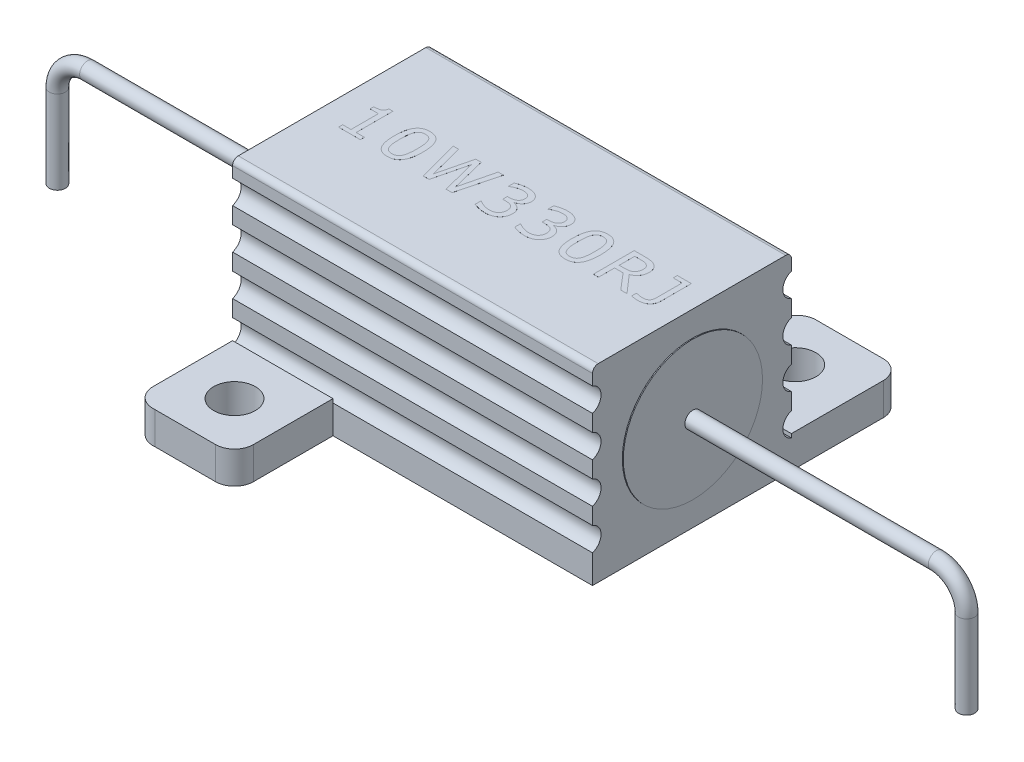
from build123d import *

# Parameters (mm, degrees)
BOSS_EXTRUDE1_DEPTH = 9.5
SKETCH2_R           = 1.1
BOSS_EXTRUDE2_DEPTH = 1.7
SKETCH3_R           = 3.675
BOSS_EXTRUDE3_DEPTH = 9.55
BOSS_EXTRUDE6_DEPTH = 0.001
SWEEP1_PROFILE_R    = 0.425


with BuildPart() as part:
    # Sketch1 → Boss-Extrude1 (new, symmetric)
    with BuildSketch(Plane(origin=(0, 0, 0), x_dir=(0, 0, -1), z_dir=(1, 0, 0))):
        with BuildLine():
            Line((-4.95, 5), (4.95, 5))
            ThreePointArc((4.95, 5), (5.162132034, 4.912132034), (5.25, 4.7))
            Line((5.25, 4.7), (5.25, 4.125))
            ThreePointArc((5.25, 4.125), (4.8, 3.5), (5.25, 2.875))
            Line((5.25, 2.875), (5.25, 2))
            ThreePointArc((5.25, 2), (4.8, 1.375), (5.25, 0.75))
            Line((5.25, 0.75), (5.25, -0.125))
            ThreePointArc((5.25, -0.125), (4.8, -0.75), (5.25, -1.375))
            Line((5.25, -1.375), (5.25, -2.25))
            ThreePointArc((5.25, -2.25), (4.8, -2.875), (5.25, -3.5))
            Line((5.25, -3.5), (5.25, -5))
            Line((5.25, -5), (-5.25, -5))
            Line((-5.25, -5), (-5.25, -3.5))
            ThreePointArc((-5.25, -3.5), (-4.8, -2.875), (-5.25, -2.25))
            Line((-5.25, -2.25), (-5.25, -1.375))
            ThreePointArc((-5.25, -1.375), (-4.8, -0.75), (-5.25, -0.125))
            Line((-5.25, -0.125), (-5.25, 0.75))
            ThreePointArc((-5.25, 0.75), (-4.8, 1.375), (-5.25, 2))
            Line((-5.25, 2), (-5.25, 2.875))
            ThreePointArc((-5.25, 2.875), (-4.8, 3.5), (-5.25, 4.125))
            Line((-5.25, 4.125), (-5.25, 4.7))
            ThreePointArc((-5.25, 4.7), (-5.162132034, 4.912132034), (-4.95, 5))
        make_face()
    extrude(amount=BOSS_EXTRUDE1_DEPTH, both=True)

    # Sketch2 → Boss-Extrude2 (add)
    # profile 1 of 2: a face of its own
    with BuildSketch(Plane.XZ.offset(5)):
        with BuildLine():
            Line((-4.2, 9.45), (-4.2, 5.25))
            Line((-4.2, 5.25), (-9.5, 5.25))
            Line((-9.5, 5.25), (-9.5, 9.455012563))
            ThreePointArc((-9.5, 9.455012563), (-9.170820393, 10.196632412), (-8.4, 10.45))
            Line((-8.4, 10.45), (-5.2, 10.45))
            ThreePointArc((-5.2, 10.45), (-4.492893219, 10.157106781), (-4.2, 9.45))
        make_face()
        with Locations((-6.8, 7.85)):
            Circle(SKETCH2_R, mode=Mode.SUBTRACT)
    # profile 2 of 2: a face of its own
    with BuildSketch(Plane.XZ.offset(5)):
        with BuildLine():
            Line((4, -9.8), (4, -5.25))
            Line((4, -5.25), (9.5, -5.25))
            Line((9.5, -5.25), (9.5, -10.1))
            ThreePointArc((9.5, -10.1), (9.207106781, -10.807106781), (8.5, -11.1))
            Line((8.5, -11.1), (5, -11.1))
            ThreePointArc((5, -11.1), (4.160975821, -10.71078783), (4, -9.8))
        make_face()
        with Locations((6.45, -8.5)):
            Circle(SKETCH2_R, mode=Mode.SUBTRACT)
    extrude(amount=-BOSS_EXTRUDE2_DEPTH)

    # Sketch3 → Boss-Extrude3 (add, symmetric)
    with BuildSketch(Plane(origin=(0, 0, 0), x_dir=(0, 0, -1), z_dir=(1, 0, 0))):
        Circle(SKETCH3_R)
    extrude(amount=BOSS_EXTRUDE3_DEPTH, both=True)

    # Sketch7 → Boss-Extrude6 (add)
    # profile 1 of 8: a face of its own
    with BuildSketch(Plane(origin=(0, 5, 0), x_dir=(1, 0, 0), z_dir=(0, 1, 0))):
        with BuildLine():
            add(Edge.make_bspline(
                [(8.301500939, -0.428209134), (8.301062759, -0.451139319), (8.300207962, -0.495871214), (8.29201733, -0.560917209), (8.278328298, -0.621921589), (8.259611151, -0.678890096), (8.235685509, -0.732088674), (8.205617016, -0.780816478), (8.170282201, -0.825541687), (8.130173555, -0.866207529), (8.085145884, -0.902021533), (8.036294909, -0.933177949), (7.983967978, -0.959998554), (7.927662195, -0.980985193), (7.868126832, -0.99839108), (7.804646886, -1.010168803), (7.737531753, -1.016882767), (7.691588805, -1.01795472), (7.66809833, -1.018502806)],
                knots=[0, 0, 0, 0, 1.120755748, 2.186355242, 3.198933757, 4.173448826, 5.113591064, 6.0441882, 6.96548279, 7.895169476, 8.830564272, 9.772249413, 10.724232925, 11.699641407, 12.705819706, 13.753628003, 14.85143754, 16, 16, 16, 16], degree=3))
            add(Edge.make_bspline(
                [(7.66809833, -1.018502806), (7.655576493, -1.018281429), (7.628669118, -1.017805726), (7.585391188, -1.015631182), (7.536466535, -1.011576798), (7.483500798, -1.006784825), (7.430017002, -1.000454105), (7.379492216, -0.993714401), (7.333455228, -0.98665922), (7.304569248, -0.980766212), (7.29078842, -0.977954795)],
                knots=[0, 0, 0, 0, 0.791051374, 1.699839779, 2.736493337, 3.89186054, 5.058981669, 6.138045988, 7.111705107, 8, 8, 8, 8], degree=3))
            Line((7.29078842, -0.977954795), (7.29078842, -0.718020706))
            Line((7.29078842, -0.718020706), (7.307007624, -0.718020706))
            add(Edge.make_bspline(
                [(7.307007624, -0.718020706), (7.317518242, -0.721073113), (7.339727339, -0.727522896), (7.374934936, -0.736281462), (7.413680531, -0.745198697), (7.469865845, -0.758120324), (7.544005961, -0.769903904), (7.604451824, -0.771734522), (7.634806279, -0.772653815)],
                knots=[0, 0, 0, 0, 0.590882725, 1.248544343, 1.958456919, 2.737484183, 4.36164324, 6, 6, 6, 6], degree=3))
            add(Edge.make_bspline(
                [(7.634806279, -0.772653815), (7.656166994, -0.772461792), (7.696565415, -0.77209863), (7.753750946, -0.765824302), (7.804166318, -0.756974089), (7.848135312, -0.743827985), (7.885713307, -0.726302863), (7.918530574, -0.706683731), (7.945823511, -0.682713598), (7.959908837, -0.664069505), (7.966873146, -0.654851173)],
                knots=[0, 0, 0, 0, 1.398250317, 2.64443893, 3.76295224, 4.747439987, 5.639718209, 6.472395588, 7.244695641, 8, 8, 8, 8], degree=3))
            add(Edge.make_bspline(
                [(7.966873146, -0.654851173), (7.973123074, -0.644754521), (7.985890653, -0.624128716), (8.00018326, -0.589718454), (8.010856248, -0.552166937), (8.01792722, -0.511357587), (8.022046048, -0.467230454), (8.026382554, -0.420034325), (8.027586578, -0.36945425), (8.028080428, -0.334734153), (8.028335394, -0.31680881)],
                knots=[0, 0, 0, 0, 0.816858895, 1.668708864, 2.555793622, 3.501563013, 4.516682111, 5.608029468, 6.765069871, 8, 8, 8, 8], degree=3))
            Line((8.028335394, -0.31680881), (8.028335394, 0.948289124))
            Line((8.028335394, 0.948289124), (7.563953966, 0.948289124))
            Line((7.563953966, 0.948289124), (7.563953966, 1.166821561))
            Line((7.563953966, 1.166821561), (8.301500939, 1.166821561))
            Line((8.301500939, 1.166821561), (8.301500939, -0.428209134))
        make_face()
    # profile 2 of 8: a face of its own
    with BuildSketch(Plane(origin=(0, 5, 0), x_dir=(1, 0, 0), z_dir=(0, 1, 0))):
        with BuildLine():
            Line((7.061329361, -0.991186252), (6.732677064, -0.991186252))
            Line((6.732677064, -0.991186252), (6.009642009, -0.144373059))
            Line((6.009642009, -0.144373059), (5.558918859, -0.144373059))
            Line((5.558918859, -0.144373059), (5.558918859, -0.991186252))
            Line((5.558918859, -0.991186252), (5.285753313, -0.991186252))
            Line((5.285753313, -0.991186252), (5.285753313, 1.166821561))
            Line((5.285753313, 1.166821561), (5.881168839, 1.166821561))
            add(Edge.make_bspline(
                [(5.881168839, 1.166821561), (5.911904641, 1.166472923), (5.970853538, 1.165804262), (6.055196595, 1.161362849), (6.131528924, 1.153188929), (6.200821451, 1.142460798), (6.264493868, 1.126868517), (6.324352246, 1.106865387), (6.38084595, 1.081349474), (6.416018135, 1.06031351), (6.433475427, 1.049872562)],
                knots=[0, 0, 0, 0, 1.288415781, 2.47108201, 3.538680541, 4.505415573, 5.408010686, 6.28309489, 7.147834801, 8, 8, 8, 8], degree=3))
            add(Edge.make_bspline(
                [(6.433475427, 1.049872562), (6.452026827, 1.037078239), (6.488585095, 1.011865139), (6.537119705, 0.96673622), (6.579672909, 0.917229328), (6.615529177, 0.862228728), (6.645093896, 0.801194489), (6.664320145, 0.732114873), (6.677231551, 0.655974161), (6.678326802, 0.602624186), (6.678897597, 0.574820604)],
                knots=[0, 0, 0, 0, 0.963681284, 1.899076006, 2.827943621, 3.752026167, 4.702860247, 5.71857009, 6.811022445, 8, 8, 8, 8], degree=3))
            add(Edge.make_bspline(
                [(6.678897597, 0.574820604), (6.678625354, 0.555598427), (6.678091765, 0.517923456), (6.672258237, 0.462607834), (6.663428322, 0.409685206), (6.651117052, 0.358950296), (6.6348117, 0.310761633), (6.615286137, 0.264774292), (6.591531855, 0.221526872), (6.564676259, 0.18058669), (6.534747071, 0.141998395), (6.501618388, 0.106199002), (6.466249688, 0.072220036), (6.427699426, 0.041172177), (6.386656883, 0.012446678), (6.342851411, -0.013476084), (6.29674251, -0.037756999), (6.264283621, -0.051287438), (6.24780822, -0.058155184)],
                knots=[0, 0, 0, 0, 1.126128489, 2.207182719, 3.255820935, 4.268986334, 5.263032379, 6.234153775, 7.193063852, 8.150486488, 9.10116855, 10.051301984, 11.006725633, 11.972966631, 12.949086479, 13.94005042, 14.954415947, 16, 16, 16, 16], degree=3))
            Line((6.24780822, -0.058155184), (7.061329361, -0.991186252))
        make_face()
        with BuildLine():
            add(Edge.make_bspline(
                [(6.378415496, 0.557747758), (6.377971198, 0.572844297), (6.377099984, 0.602446679), (6.371324006, 0.645451141), (6.360741748, 0.685692535), (6.3469982, 0.723523011), (6.327871321, 0.758604596), (6.303778717, 0.790961831), (6.274058419, 0.820260432), (6.251042386, 0.836627929), (6.239271797, 0.844998402)],
                knots=[0, 0, 0, 0, 1.085368415, 2.128268547, 3.1106313, 4.071895604, 5.014699805, 5.972038339, 6.962883605, 8, 8, 8, 8], degree=3))
            add(Edge.make_bspline(
                [(6.239271797, 0.844998402), (6.228604901, 0.85180502), (6.207086192, 0.865536253), (6.17141029, 0.881662578), (6.133145922, 0.894956933), (6.091691298, 0.904385193), (6.047293245, 0.912407267), (5.999182294, 0.916968655), (5.947387007, 0.920798106), (5.911624057, 0.92091308), (5.893119831, 0.92097257)],
                knots=[0, 0, 0, 0, 0.843459406, 1.701540853, 2.6053125, 3.542575708, 4.535326681, 5.614234208, 6.765573065, 8, 8, 8, 8], degree=3))
            Line((5.893119831, 0.92097257), (5.558918859, 0.92097257))
            Line((5.558918859, 0.92097257), (5.558918859, 0.101475932))
            Line((5.558918859, 0.101475932), (5.846169503, 0.101475932))
            add(Edge.make_bspline(
                [(5.846169503, 0.101475932), (5.867940616, 0.101875983), (5.910102619, 0.102650723), (5.971162163, 0.106530503), (6.027777382, 0.114646486), (6.080634985, 0.124057898), (6.129372962, 0.139365906), (6.174597803, 0.158655492), (6.215627535, 0.184205627), (6.239932801, 0.204747189), (6.252076431, 0.215010362)],
                knots=[0, 0, 0, 0, 1.210655428, 2.344558938, 3.398352313, 4.389640028, 5.325372474, 6.232137918, 7.116723723, 8, 8, 8, 8], degree=3))
            add(Edge.make_bspline(
                [(6.252076431, 0.215010362), (6.262457948, 0.225435283), (6.282891639, 0.245954405), (6.308447076, 0.280726063), (6.330481884, 0.317018657), (6.348305899, 0.35624545), (6.362124373, 0.399316777), (6.371832469, 0.447392266), (6.377073819, 0.500864381), (6.377955501, 0.538245239), (6.378415496, 0.557747758)],
                knots=[0, 0, 0, 0, 0.936271895, 1.842841591, 2.741489519, 3.638077323, 4.58130199, 5.617848582, 6.75717263, 8, 8, 8, 8], degree=3))
        make_face(mode=Mode.SUBTRACT)
    # profile 3 of 8: a face of its own
    with BuildSketch(Plane(origin=(0, 5, 0), x_dir=(1, 0, 0), z_dir=(0, 1, 0))):
        with BuildLine():
            add(Edge.make_bspline(
                [(4.591912826, 0.089098118), (4.591353613, 0.041848931), (4.590272953, -0.049458383), (4.581610809, -0.181638091), (4.567992152, -0.304102208), (4.548113125, -0.416947039), (4.522086392, -0.519875811), (4.491359082, -0.613537941), (4.454273883, -0.697330653), (4.411111584, -0.771557169), (4.361383045, -0.836281508), (4.306227081, -0.89291909), (4.243999476, -0.940318371), (4.175378527, -0.978887087), (4.100625831, -1.009523582), (4.01934013, -1.030460626), (3.932048472, -1.043592204), (3.871772552, -1.045061906), (3.840707575, -1.045819361)],
                knots=[0, 0, 0, 0, 1.462515791, 2.826257887, 4.098588437, 5.27524076, 6.370122553, 7.382635979, 8.323051561, 9.201518962, 10.033957328, 10.843681618, 11.641751814, 12.446417794, 13.274089048, 14.135116487, 15.038877147, 16, 16, 16, 16], degree=3))
            add(Edge.make_bspline(
                [(3.840707575, -1.045819361), (3.809212218, -1.045098232), (3.74805899, -1.043698047), (3.659634021, -1.030066088), (3.5776768, -1.008737016), (3.502453028, -0.977966512), (3.433460505, -0.939199462), (3.371546893, -0.890664903), (3.315852417, -0.833906211), (3.267463826, -0.767632726), (3.225245962, -0.692694118), (3.188330153, -0.608837037), (3.158064046, -0.515475498), (3.133099403, -0.412986518), (3.113023383, -0.301410168), (3.099241818, -0.18037659), (3.091304605, -0.050010601), (3.090116532, 0.040002392), (3.089502324, 0.086537191)],
                knots=[0, 0, 0, 0, 0.975561823, 1.894207913, 2.765987644, 3.594712337, 4.406414096, 5.210884434, 6.024787292, 6.863552976, 7.746360406, 8.68618482, 9.698595331, 10.784175386, 11.95364431, 13.210072149, 14.557666754, 16, 16, 16, 16], degree=3))
            add(Edge.make_bspline(
                [(3.089502324, 0.086537191), (3.090065458, 0.133359552), (3.091155063, 0.223956004), (3.099777381, 0.355000449), (3.113451301, 0.476611919), (3.133437337, 0.588673687), (3.158839964, 0.691437414), (3.189724778, 0.785011098), (3.226741865, 0.86901978), (3.26958212, 0.943767297), (3.318583977, 1.009428031), (3.37406986, 1.066527212), (3.436481632, 1.114483883), (3.504939473, 1.154241965), (3.57996298, 1.184704721), (3.661388042, 1.205601292), (3.748902543, 1.219364942), (3.809494326, 1.220744173), (3.840707575, 1.22145467)],
                knots=[0, 0, 0, 0, 1.450126419, 2.805845482, 4.065763501, 5.238744047, 6.328896909, 7.341983365, 8.2869572, 9.167511018, 10.004780552, 10.818108853, 11.62549425, 12.434993413, 13.263133086, 14.124647823, 15.033931127, 16, 16, 16, 16], degree=3))
            add(Edge.make_bspline(
                [(3.840707575, 1.22145467), (3.872198672, 1.220719142), (3.933343628, 1.219290997), (4.021863604, 1.205850454), (4.103830389, 1.183766123), (4.179386413, 1.15307733), (4.247893205, 1.112871696), (4.310048073, 1.06419704), (4.36557078, 1.006491624), (4.413826829, 0.939473181), (4.456306068, 0.863970861), (4.492829151, 0.779667173), (4.523323976, 0.686246914), (4.548896734, 0.584304748), (4.568214851, 0.473149532), (4.582207954, 0.353177198), (4.590091653, 0.224079336), (4.591292665, 0.135063048), (4.591912826, 0.089098118)],
                knots=[0, 0, 0, 0, 0.976576377, 1.896177831, 2.770013405, 3.605358433, 4.418491692, 5.226516336, 6.047603033, 6.894359061, 7.781924088, 8.73081062, 9.740083278, 10.827858728, 11.989075843, 13.238041405, 14.5738202, 16, 16, 16, 16], degree=3))
        make_face()
        with BuildLine():
            add(Edge.make_bspline(
                [(4.204786029, -0.571621046), (4.212790423, -0.551103816), (4.229194022, -0.509057354), (4.24826829, -0.441937656), (4.262958171, -0.369841197), (4.27394369, -0.292130347), (4.281927947, -0.207948723), (4.287228022, -0.116116364), (4.290682758, -0.016210645), (4.291175043, 0.053099756), (4.291430726, 0.089098118)],
                knots=[0, 0, 0, 0, 0.787920239, 1.614704221, 2.493559176, 3.419679904, 4.422442709, 5.519279532, 6.711566037, 8, 8, 8, 8], degree=3))
            add(Edge.make_bspline(
                [(4.291430726, 0.089098118), (4.291172523, 0.124811988), (4.290673481, 0.193837932), (4.287219407, 0.293599845), (4.281890217, 0.386144012), (4.273857773, 0.471584061), (4.263298559, 0.550551176), (4.247721713, 0.622773387), (4.229217685, 0.689254479), (4.211897155, 0.730051576), (4.203505566, 0.749817282)],
                knots=[0, 0, 0, 0, 1.277209098, 2.468524563, 3.569546968, 4.59175249, 5.537266852, 6.41645201, 7.232789931, 8, 8, 8, 8], degree=3))
            add(Edge.make_bspline(
                [(4.203505566, 0.749817282), (4.194664368, 0.767537488), (4.177466934, 0.8020059), (4.145564361, 0.848757326), (4.107644428, 0.887422179), (4.06599911, 0.920240868), (4.018280356, 0.945380836), (3.964698204, 0.963246088), (3.904729496, 0.973970072), (3.862664133, 0.975044741), (3.840707575, 0.975605679)],
                knots=[0, 0, 0, 0, 1.041868962, 2.026588758, 2.964039316, 3.882297917, 4.806977878, 5.787445238, 6.845128519, 8, 8, 8, 8], degree=3))
            add(Edge.make_bspline(
                [(3.840707575, 0.975605679), (3.819033587, 0.975044649), (3.777389248, 0.973966689), (3.717745127, 0.96312823), (3.663882424, 0.945317559), (3.615536568, 0.920184203), (3.572608741, 0.887757614), (3.535306203, 0.84744272), (3.501405477, 0.800916412), (3.48420456, 0.765493741), (3.475348658, 0.747256355)],
                knots=[0, 0, 0, 0, 1.130982529, 2.173066616, 3.152892545, 4.083472911, 5.006338149, 5.947185184, 6.943106974, 8, 8, 8, 8], degree=3))
            add(Edge.make_bspline(
                [(3.475348658, 0.747256355), (3.467417683, 0.728045244), (3.450731904, 0.687627465), (3.432547298, 0.620820724), (3.417779586, 0.546216536), (3.407024356, 0.464202415), (3.399782112, 0.376146599), (3.394240555, 0.283357597), (3.390776038, 0.186296991), (3.390252013, 0.120258923), (3.389984424, 0.086537191)],
                knots=[0, 0, 0, 0, 0.743461611, 1.564150376, 2.473168407, 3.465097376, 4.523434166, 5.635793492, 6.792739709, 8, 8, 8, 8], degree=3))
            add(Edge.make_bspline(
                [(3.389984424, 0.086537191), (3.390105774, 0.050255661), (3.390338051, -0.019191166), (3.393245481, -0.118821509), (3.398462643, -0.209177721), (3.404798114, -0.291280735), (3.415040476, -0.366733574), (3.429500009, -0.437366153), (3.448282498, -0.504222076), (3.465294976, -0.546288192), (3.473641373, -0.566926013)],
                knots=[0, 0, 0, 0, 1.312806302, 2.512855192, 3.605999759, 4.587601144, 5.491851682, 6.359134938, 7.194984378, 8, 8, 8, 8], degree=3))
            add(Edge.make_bspline(
                [(3.473641373, -0.566926013), (3.481983691, -0.58496742), (3.498169428, -0.619971292), (3.529868167, -0.66709745), (3.5663186, -0.707718596), (3.608293817, -0.741739158), (3.656700257, -0.768158492), (3.711785998, -0.786953231), (3.773975439, -0.797923201), (3.817755499, -0.799266259), (3.840707575, -0.799970369)],
                knots=[0, 0, 0, 0, 1.023553745, 1.985895355, 2.915557442, 3.828632731, 4.757744765, 5.743701395, 6.817115868, 8, 8, 8, 8], degree=3))
            add(Edge.make_bspline(
                [(3.840707575, -0.799970369), (3.862378446, -0.799395458), (3.904156905, -0.798287107), (3.963978402, -0.787577787), (4.018038662, -0.769562447), (4.066669606, -0.744690867), (4.109618091, -0.712079271), (4.146985289, -0.672038938), (4.180027505, -0.625282326), (4.196374099, -0.589852946), (4.204786029, -0.571621046)],
                knots=[0, 0, 0, 0, 1.131665358, 2.181695236, 3.162112733, 4.099850787, 5.023273204, 5.964688273, 6.952632, 8, 8, 8, 8], degree=3))
        make_face(mode=Mode.SUBTRACT)
    # profile 4 of 8: a face of its own
    with BuildSketch(Plane(origin=(0, 5, 0), x_dir=(1, 0, 0), z_dir=(0, 1, 0))):
        with BuildLine():
            add(Edge.make_bspline(
                [(2.318407206, 0.038306399), (2.329741877, 0.027434295), (2.352615246, 0.005494383), (2.382892552, -0.031934161), (2.409892637, -0.07333568), (2.434112542, -0.118776204), (2.454238928, -0.169975043), (2.467949121, -0.227843913), (2.475894509, -0.292543562), (2.47702037, -0.337841448), (2.477611501, -0.361625033)],
                knots=[0, 0, 0, 0, 0.847484043, 1.710223126, 2.592412854, 3.513457184, 4.486482436, 5.554204071, 6.715838676, 8, 8, 8, 8], degree=3))
            add(Edge.make_bspline(
                [(2.477611501, -0.361625033), (2.476937271, -0.385842565), (2.475614812, -0.433343646), (2.465716048, -0.503231019), (2.448546894, -0.569828116), (2.425105262, -0.633219159), (2.395381115, -0.692643501), (2.36075859, -0.748659023), (2.320114662, -0.800530108), (2.289134304, -0.831706064), (2.273590984, -0.847347519)],
                knots=[0, 0, 0, 0, 1.072189339, 2.103028086, 3.117625413, 4.112331199, 5.08999265, 6.054966346, 7.024146796, 8, 8, 8, 8], degree=3))
            add(Edge.make_bspline(
                [(2.273590984, -0.847347519), (2.255007504, -0.863568109), (2.217858512, -0.895993608), (2.155782418, -0.937102328), (2.08888788, -0.97110119), (2.017773094, -0.999149828), (1.94220383, -1.019586564), (1.863234345, -1.035151263), (1.780536157, -1.044138454), (1.724293334, -1.045252498), (1.695675126, -1.045819361)],
                knots=[0, 0, 0, 0, 0.94513944, 1.889365109, 2.845868606, 3.818496383, 4.815247057, 5.843513068, 6.902708155, 8, 8, 8, 8], degree=3))
            add(Edge.make_bspline(
                [(1.695675126, -1.045819361), (1.665777311, -1.045376896), (1.606296979, -1.044496634), (1.517391805, -1.035848328), (1.429287983, -1.022876996), (1.34319404, -1.004498486), (1.261569014, -0.982961931), (1.186434494, -0.959915109), (1.118750997, -0.936407467), (1.076982145, -0.918562746), (1.057150663, -0.91009023)],
                knots=[0, 0, 0, 0, 1.091633847, 2.17175542, 3.259350248, 4.342654255, 5.384955613, 6.341552815, 7.212583926, 8, 8, 8, 8], degree=3))
            Line((1.057150663, -0.91009023), (1.057150663, -0.608754487))
            Line((1.057150663, -0.608754487), (1.078918542, -0.608754487))
            add(Edge.make_bspline(
                [(1.078918542, -0.608754487), (1.100088183, -0.622133339), (1.143267128, -0.649421694), (1.212675866, -0.685678955), (1.287680816, -0.718009289), (1.366775349, -0.746516831), (1.447828738, -0.770727221), (1.528884681, -0.786917953), (1.608441044, -0.798006767), (1.661066301, -0.799319831), (1.687138703, -0.799970369)],
                knots=[0, 0, 0, 0, 0.930231768, 1.897359876, 2.905960645, 3.962824014, 5.020110383, 6.045473768, 7.03165901, 8, 8, 8, 8], degree=3))
            add(Edge.make_bspline(
                [(1.687138703, -0.799970369), (1.702524549, -0.799696379), (1.733979242, -0.799136234), (1.78157488, -0.792637156), (1.830638332, -0.783271261), (1.880073441, -0.770325679), (1.928205586, -0.753863565), (1.972288722, -0.732742977), (2.0121121, -0.708795986), (2.034953095, -0.689177175), (2.046095303, -0.679606801)],
                knots=[0, 0, 0, 0, 0.955105117, 1.9526087, 2.978673282, 4.056885304, 5.124578998, 6.132597257, 7.089050672, 8, 8, 8, 8], degree=3))
            add(Edge.make_bspline(
                [(2.046095303, -0.679606801), (2.056750154, -0.668888517), (2.077648257, -0.647866001), (2.103936315, -0.612773119), (2.126923709, -0.576886681), (2.145739319, -0.538637893), (2.160002434, -0.496623092), (2.170042133, -0.450097137), (2.175929865, -0.39848164), (2.17671784, -0.362494632), (2.177129401, -0.343698544)],
                knots=[0, 0, 0, 0, 0.974089691, 1.910549984, 2.822386268, 3.721564009, 4.653513387, 5.678162238, 6.787299389, 8, 8, 8, 8], degree=3))
            add(Edge.make_bspline(
                [(2.177129401, -0.343698544), (2.176837024, -0.325173071), (2.176274492, -0.289530157), (2.168779715, -0.238788019), (2.157566489, -0.192802842), (2.141053424, -0.151945396), (2.121029727, -0.115242734), (2.096900645, -0.083056232), (2.069413945, -0.054766153), (2.048461572, -0.039383412), (2.037985701, -0.031692272)],
                knots=[0, 0, 0, 0, 1.246176778, 2.397637793, 3.445421562, 4.425515979, 5.35590216, 6.252488577, 7.126270542, 8, 8, 8, 8], degree=3))
            add(Edge.make_bspline(
                [(2.037985701, -0.031692272), (2.026625641, -0.024425635), (2.003665938, -0.009739109), (1.965364578, 0.007238614), (1.923883914, 0.020882292), (1.863013011, 0.034365989), (1.781077875, 0.044359602), (1.714058006, 0.045997291), (1.679455922, 0.046842823)],
                knots=[0, 0, 0, 0, 0.651204319, 1.316142418, 2.018760635, 2.759665618, 4.327028642, 6, 6, 6, 6], degree=3))
            Line((1.679455922, 0.046842823), (1.548848645, 0.046842823))
            Line((1.548848645, 0.046842823), (1.548848645, 0.292691814))
            Line((1.548848645, 0.292691814), (1.648297977, 0.292691814))
            add(Edge.make_bspline(
                [(1.648297977, 0.292691814), (1.66595428, 0.292837097), (1.70033873, 0.293120025), (1.750328651, 0.298212538), (1.797777688, 0.305110136), (1.842351107, 0.315946423), (1.884410525, 0.329008417), (1.923681373, 0.345234282), (1.959875418, 0.365105176), (1.993793279, 0.387046385), (2.024115449, 0.412163424), (2.050561429, 0.440226785), (2.072762961, 0.471171042), (2.09142969, 0.504706991), (2.105474388, 0.541228751), (2.115143592, 0.580391041), (2.121288164, 0.622147447), (2.122085541, 0.650914719), (2.122496292, 0.665733513)],
                knots=[0, 0, 0, 0, 1.240419804, 2.415633327, 3.528743283, 4.608144501, 5.636053556, 6.622252983, 7.58878585, 8.534609379, 9.457798559, 10.349242878, 11.237427791, 12.12814259, 13.039995841, 13.978654942, 14.958750962, 16, 16, 16, 16], degree=3))
            add(Edge.make_bspline(
                [(2.122496292, 0.665733513), (2.122069319, 0.678842931), (2.121243136, 0.70420941), (2.115332252, 0.741167284), (2.104520956, 0.775378833), (2.089925419, 0.807152569), (2.07187676, 0.836408978), (2.050480596, 0.863045796), (2.025502928, 0.886716611), (2.006849387, 0.90012316), (1.99743769, 0.906887471)],
                knots=[0, 0, 0, 0, 1.109336041, 2.146544552, 3.155699887, 4.136221373, 5.098536494, 6.057531715, 7.019922155, 8, 8, 8, 8], degree=3))
            add(Edge.make_bspline(
                [(1.99743769, 0.906887471), (1.987160948, 0.913064867), (1.96667433, 0.925379465), (1.934007817, 0.940233071), (1.900299567, 0.952219099), (1.852637139, 0.964403863), (1.787779443, 0.97351487), (1.734405411, 0.974885246), (1.706345655, 0.975605679)],
                knots=[0, 0, 0, 0, 0.711216309, 1.417805135, 2.125604048, 2.832243336, 4.334649322, 6, 6, 6, 6], degree=3))
            add(Edge.make_bspline(
                [(1.706345655, 0.975605679), (1.683269074, 0.97502669), (1.636079402, 0.973842705), (1.564393765, 0.964024989), (1.49062437, 0.947871921), (1.415311646, 0.926536541), (1.340240749, 0.898557706), (1.266225965, 0.866444488), (1.194663135, 0.828324551), (1.149151502, 0.799077554), (1.126295691, 0.784389797)],
                knots=[0, 0, 0, 0, 0.894418222, 1.829010174, 2.799457441, 3.820802859, 4.860878205, 5.903159842, 6.946972907, 8, 8, 8, 8], degree=3))
            Line((1.126295691, 0.784389797), (1.111783772, 0.784389797))
            Line((1.111783772, 0.784389797), (1.111783772, 1.085725539))
            add(Edge.make_bspline(
                [(1.111783772, 1.085725539), (1.130179631, 1.094212209), (1.169266543, 1.112244404), (1.233638672, 1.135887408), (1.306581323, 1.158120227), (1.386207009, 1.179576025), (1.469516631, 1.198425731), (1.553390751, 1.211306909), (1.635876039, 1.220082451), (1.690388892, 1.220999533), (1.717443006, 1.22145467)],
                knots=[0, 0, 0, 0, 0.777624147, 1.652270079, 2.630230247, 3.704883216, 4.818215269, 5.907609184, 6.961570091, 8, 8, 8, 8], degree=3))
            add(Edge.make_bspline(
                [(1.717443006, 1.22145467), (1.742920014, 1.221176123), (1.792373902, 1.22063543), (1.864221425, 1.215065661), (1.93133547, 1.20567354), (1.994334565, 1.193027788), (2.053465045, 1.175950294), (2.109442777, 1.154422096), (2.162489496, 1.12869606), (2.195385284, 1.10767591), (2.211701915, 1.097249711)],
                knots=[0, 0, 0, 0, 1.181529625, 2.293488736, 3.339666156, 4.323260697, 5.271417361, 6.190562388, 7.102501307, 8, 8, 8, 8], degree=3))
            add(Edge.make_bspline(
                [(2.211701915, 1.097249711), (2.228409351, 1.085295121), (2.261094397, 1.06190815), (2.303557239, 1.020135481), (2.340278428, 0.975244826), (2.370248872, 0.926210439), (2.394141735, 0.87337885), (2.411203981, 0.816439676), (2.421026834, 0.755136982), (2.422315741, 0.71300408), (2.422978392, 0.691342783)],
                knots=[0, 0, 0, 0, 1.030246025, 2.015488056, 2.980657051, 3.93641939, 4.892528807, 5.884791777, 6.912532717, 8, 8, 8, 8], degree=3))
            add(Edge.make_bspline(
                [(2.422978392, 0.691342783), (2.422501414, 0.676248291), (2.421562259, 0.646527681), (2.416114119, 0.60258299), (2.406079219, 0.560391802), (2.392863646, 0.519273126), (2.375444895, 0.479777148), (2.353774872, 0.441891408), (2.328475629, 0.40548683), (2.299680813, 0.37088041), (2.26821743, 0.338550217), (2.234898687, 0.309298653), (2.200729998, 0.282446054), (2.164740251, 0.259249653), (2.127007601, 0.239951347), (2.088508679, 0.22244103), (2.048332455, 0.208725709), (2.020691673, 0.202393869), (2.006827756, 0.199217979)],
                knots=[0, 0, 0, 0, 1.040593361, 2.04889782, 3.04554796, 4.02546284, 5.02211298, 6.014605761, 7.029232238, 8.073837562, 9.114015009, 10.135206882, 11.127699663, 12.1069274, 13.080640536, 14.04642105, 15.020134186, 16, 16, 16, 16], degree=3))
            Line((2.006827756, 0.199217979), (2.006827756, 0.178730563))
            add(Edge.make_bspline(
                [(2.006827756, 0.178730563), (2.018818421, 0.176485879), (2.044012575, 0.171769466), (2.082543871, 0.160803738), (2.123754457, 0.147128187), (2.166362659, 0.130340707), (2.20887412, 0.111196557), (2.248920893, 0.089557838), (2.285740231, 0.065721423), (2.307624758, 0.047355327), (2.318407206, 0.038306399)],
                knots=[0, 0, 0, 0, 0.847072829, 1.779824847, 2.779997163, 3.862895895, 4.959821874, 6.016836294, 7.022900478, 8, 8, 8, 8], degree=3))
        make_face()
    # profile 5 of 8: a face of its own
    with BuildSketch(Plane(origin=(0, 5, 0), x_dir=(1, 0, 0), z_dir=(0, 1, 0))):
        with BuildLine():
            add(Edge.make_bspline(
                [(0.231422436, 0.038306399), (0.242757106, 0.027434295), (0.265630475, 0.005494383), (0.295907781, -0.031934161), (0.322907867, -0.07333568), (0.347127771, -0.118776204), (0.367254158, -0.169975043), (0.38096435, -0.227843913), (0.388909738, -0.292543562), (0.390035599, -0.337841448), (0.390626731, -0.361625033)],
                knots=[0, 0, 0, 0, 0.847484043, 1.710223126, 2.592412854, 3.513457184, 4.486482436, 5.554204071, 6.715838676, 8, 8, 8, 8], degree=3))
            add(Edge.make_bspline(
                [(0.390626731, -0.361625033), (0.3899525, -0.385842565), (0.388630041, -0.433343646), (0.378731277, -0.503231019), (0.361562124, -0.569828116), (0.338120491, -0.633219159), (0.308396345, -0.692643501), (0.273773819, -0.748659023), (0.233129891, -0.800530108), (0.202149534, -0.831706064), (0.186606214, -0.847347519)],
                knots=[0, 0, 0, 0, 1.072189339, 2.103028086, 3.117625413, 4.112331199, 5.08999265, 6.054966346, 7.024146796, 8, 8, 8, 8], degree=3))
            add(Edge.make_bspline(
                [(0.186606214, -0.847347519), (0.168022734, -0.863568109), (0.130873741, -0.895993608), (0.068797647, -0.937102328), (0.001903109, -0.97110119), (-0.069211676, -0.999149828), (-0.144780941, -1.019586564), (-0.223750426, -1.035151263), (-0.306448614, -1.044138454), (-0.362691437, -1.045252498), (-0.391309644, -1.045819361)],
                knots=[0, 0, 0, 0, 0.94513944, 1.889365109, 2.845868606, 3.818496383, 4.815247057, 5.843513068, 6.902708155, 8, 8, 8, 8], degree=3))
            add(Edge.make_bspline(
                [(-0.391309644, -1.045819361), (-0.42120746, -1.045376896), (-0.480687791, -1.044496634), (-0.569592966, -1.035848328), (-0.657696788, -1.022876996), (-0.743790731, -1.004498486), (-0.825415756, -0.982961931), (-0.900550276, -0.959915109), (-0.968233773, -0.936407467), (-1.010002626, -0.918562746), (-1.029834108, -0.91009023)],
                knots=[0, 0, 0, 0, 1.091633847, 2.17175542, 3.259350248, 4.342654255, 5.384955613, 6.341552815, 7.212583926, 8, 8, 8, 8], degree=3))
            Line((-1.029834108, -0.91009023), (-1.029834108, -0.608754487))
            Line((-1.029834108, -0.608754487), (-1.008066229, -0.608754487))
            add(Edge.make_bspline(
                [(-1.008066229, -0.608754487), (-0.986896588, -0.622133339), (-0.943717642, -0.649421694), (-0.874308904, -0.685678955), (-0.799303955, -0.718009289), (-0.720209422, -0.746516831), (-0.639156032, -0.770727221), (-0.55810009, -0.786917953), (-0.478543726, -0.798006767), (-0.425918469, -0.799319831), (-0.399846068, -0.799970369)],
                knots=[0, 0, 0, 0, 0.930231768, 1.897359876, 2.905960645, 3.962824014, 5.020110383, 6.045473768, 7.03165901, 8, 8, 8, 8], degree=3))
            add(Edge.make_bspline(
                [(-0.399846068, -0.799970369), (-0.384460221, -0.799696379), (-0.353005529, -0.799136234), (-0.305409891, -0.792637156), (-0.256346439, -0.783271261), (-0.20691133, -0.770325679), (-0.158779185, -0.753863565), (-0.114696048, -0.732742977), (-0.074872671, -0.708795986), (-0.052031675, -0.689177175), (-0.040889468, -0.679606801)],
                knots=[0, 0, 0, 0, 0.955105117, 1.9526087, 2.978673282, 4.056885304, 5.124578998, 6.132597257, 7.089050672, 8, 8, 8, 8], degree=3))
            add(Edge.make_bspline(
                [(-0.040889468, -0.679606801), (-0.030234616, -0.668888517), (-0.009336514, -0.647866001), (0.016951544, -0.612773119), (0.039938938, -0.576886681), (0.058754548, -0.538637893), (0.073017664, -0.496623092), (0.083057362, -0.450097137), (0.088945095, -0.39848164), (0.089733069, -0.362494632), (0.09014463, -0.343698544)],
                knots=[0, 0, 0, 0, 0.974089691, 1.910549984, 2.822386268, 3.721564009, 4.653513387, 5.678162238, 6.787299389, 8, 8, 8, 8], degree=3))
            add(Edge.make_bspline(
                [(0.09014463, -0.343698544), (0.089852253, -0.325173071), (0.089289722, -0.289530157), (0.081794945, -0.238788019), (0.070581719, -0.192802842), (0.054068653, -0.151945396), (0.034044956, -0.115242734), (0.009915874, -0.083056232), (-0.017570826, -0.054766153), (-0.038523198, -0.039383412), (-0.04899907, -0.031692272)],
                knots=[0, 0, 0, 0, 1.246176778, 2.397637793, 3.445421562, 4.425515979, 5.35590216, 6.252488577, 7.126270542, 8, 8, 8, 8], degree=3))
            add(Edge.make_bspline(
                [(-0.04899907, -0.031692272), (-0.06035913, -0.024425635), (-0.083318832, -0.009739109), (-0.121620192, 0.007238614), (-0.163100856, 0.020882292), (-0.223971759, 0.034365989), (-0.305906896, 0.044359602), (-0.372926765, 0.045997291), (-0.407528849, 0.046842823)],
                knots=[0, 0, 0, 0, 0.651204319, 1.316142418, 2.018760635, 2.759665618, 4.327028642, 6, 6, 6, 6], degree=3))
            Line((-0.407528849, 0.046842823), (-0.538136125, 0.046842823))
            Line((-0.538136125, 0.046842823), (-0.538136125, 0.292691814))
            Line((-0.538136125, 0.292691814), (-0.438686794, 0.292691814))
            add(Edge.make_bspline(
                [(-0.438686794, 0.292691814), (-0.421030491, 0.292837097), (-0.38664604, 0.293120025), (-0.336656119, 0.298212538), (-0.289207083, 0.305110136), (-0.244633664, 0.315946423), (-0.202574245, 0.329008417), (-0.163303397, 0.345234282), (-0.127109353, 0.365105176), (-0.093191492, 0.387046385), (-0.062869321, 0.412163424), (-0.036423341, 0.440226785), (-0.01422181, 0.471171042), (0.004444919, 0.504706991), (0.018489618, 0.541228751), (0.028158822, 0.580391041), (0.034303393, 0.622147447), (0.035100771, 0.650914719), (0.035511521, 0.665733513)],
                knots=[0, 0, 0, 0, 1.240419804, 2.415633327, 3.528743283, 4.608144501, 5.636053556, 6.622252983, 7.58878585, 8.534609379, 9.457798559, 10.349242878, 11.237427791, 12.12814259, 13.039995841, 13.978654942, 14.958750962, 16, 16, 16, 16], degree=3))
            add(Edge.make_bspline(
                [(0.035511521, 0.665733513), (0.035084549, 0.678842931), (0.034258365, 0.70420941), (0.028347481, 0.741167284), (0.017536185, 0.775378833), (0.002940649, 0.807152569), (-0.015108011, 0.836408978), (-0.036504175, 0.863045796), (-0.061481843, 0.886716611), (-0.080135384, 0.90012316), (-0.089547081, 0.906887471)],
                knots=[0, 0, 0, 0, 1.109336041, 2.146544552, 3.155699887, 4.136221373, 5.098536494, 6.057531715, 7.019922155, 8, 8, 8, 8], degree=3))
            add(Edge.make_bspline(
                [(-0.089547081, 0.906887471), (-0.099823822, 0.913064867), (-0.120310441, 0.925379465), (-0.152976953, 0.940233071), (-0.186685203, 0.952219099), (-0.234347632, 0.964403863), (-0.299205328, 0.97351487), (-0.352579359, 0.974885246), (-0.380639115, 0.975605679)],
                knots=[0, 0, 0, 0, 0.711216309, 1.417805135, 2.125604048, 2.832243336, 4.334649322, 6, 6, 6, 6], degree=3))
            add(Edge.make_bspline(
                [(-0.380639115, 0.975605679), (-0.403715697, 0.97502669), (-0.450905369, 0.973842705), (-0.522591006, 0.964024989), (-0.596360401, 0.947871921), (-0.671673124, 0.926536541), (-0.746744022, 0.898557706), (-0.820758805, 0.866444488), (-0.892321636, 0.828324551), (-0.937833268, 0.799077554), (-0.960689079, 0.784389797)],
                knots=[0, 0, 0, 0, 0.894418222, 1.829010174, 2.799457441, 3.820802859, 4.860878205, 5.903159842, 6.946972907, 8, 8, 8, 8], degree=3))
            Line((-0.960689079, 0.784389797), (-0.975200999, 0.784389797))
            Line((-0.975200999, 0.784389797), (-0.975200999, 1.085725539))
            add(Edge.make_bspline(
                [(-0.975200999, 1.085725539), (-0.95680514, 1.094212209), (-0.917718227, 1.112244404), (-0.853346098, 1.135887408), (-0.780403447, 1.158120227), (-0.700777761, 1.179576025), (-0.617468139, 1.198425731), (-0.533594019, 1.211306909), (-0.451108732, 1.220082451), (-0.396595878, 1.220999533), (-0.369541765, 1.22145467)],
                knots=[0, 0, 0, 0, 0.777624147, 1.652270079, 2.630230247, 3.704883216, 4.818215269, 5.907609184, 6.961570091, 8, 8, 8, 8], degree=3))
            add(Edge.make_bspline(
                [(-0.369541765, 1.22145467), (-0.344064756, 1.221176123), (-0.294610869, 1.22063543), (-0.222763345, 1.215065661), (-0.155649301, 1.20567354), (-0.092650205, 1.193027788), (-0.033519726, 1.175950294), (0.022458006, 1.154422096), (0.075504725, 1.12869606), (0.108400513, 1.10767591), (0.124717145, 1.097249711)],
                knots=[0, 0, 0, 0, 1.181529625, 2.293488736, 3.339666156, 4.323260697, 5.271417361, 6.190562388, 7.102501307, 8, 8, 8, 8], degree=3))
            add(Edge.make_bspline(
                [(0.124717145, 1.097249711), (0.141424581, 1.085295121), (0.174109626, 1.06190815), (0.216572469, 1.020135481), (0.253293658, 0.975244826), (0.283264102, 0.926210439), (0.307156964, 0.87337885), (0.324219211, 0.816439676), (0.334042064, 0.755136982), (0.335330971, 0.71300408), (0.335993621, 0.691342783)],
                knots=[0, 0, 0, 0, 1.030246025, 2.015488056, 2.980657051, 3.93641939, 4.892528807, 5.884791777, 6.912532717, 8, 8, 8, 8], degree=3))
            add(Edge.make_bspline(
                [(0.335993621, 0.691342783), (0.335516644, 0.676248291), (0.334577488, 0.646527681), (0.329129348, 0.60258299), (0.319094448, 0.560391802), (0.305878876, 0.519273126), (0.288460124, 0.479777148), (0.266790102, 0.441891408), (0.241490858, 0.40548683), (0.212696042, 0.37088041), (0.18123266, 0.338550217), (0.147913917, 0.309298653), (0.113745227, 0.282446054), (0.077755481, 0.259249653), (0.040022831, 0.239951347), (0.001523909, 0.22244103), (-0.038652316, 0.208725709), (-0.066293098, 0.202393869), (-0.080157015, 0.199217979)],
                knots=[0, 0, 0, 0, 1.040593361, 2.04889782, 3.04554796, 4.02546284, 5.02211298, 6.014605761, 7.029232238, 8.073837562, 9.114015009, 10.135206882, 11.127699663, 12.1069274, 13.080640536, 14.04642105, 15.020134186, 16, 16, 16, 16], degree=3))
            Line((-0.080157015, 0.199217979), (-0.080157015, 0.178730563))
            add(Edge.make_bspline(
                [(-0.080157015, 0.178730563), (-0.06816635, 0.176485879), (-0.042972196, 0.171769466), (-0.0044409, 0.160803738), (0.036769686, 0.147128187), (0.079377888, 0.130340707), (0.12188935, 0.111196557), (0.161936123, 0.089557838), (0.198755461, 0.065721423), (0.220639987, 0.047355327), (0.231422436, 0.038306399)],
                knots=[0, 0, 0, 0, 0.847072829, 1.779824847, 2.779997163, 3.862895895, 4.959821874, 6.016836294, 7.022900478, 8, 8, 8, 8], degree=3))
        make_face()
    # profile 6 of 8: a face of its own
    with BuildSketch(Plane(origin=(0, 5, 0), x_dir=(1, 0, 0), z_dir=(0, 1, 0))):
        Polygon((-1.614408376, 1.166821561), (-2.171409997, -0.991186252), (-2.492379514, -0.991186252), (-2.942675843, 0.80018218), (-3.383155286, -0.991186252), (-3.696868842, -0.991186252), (-4.264114171, 1.166821561), (-3.981985381, 1.166821561), (-3.521445343, -0.627534619), (-3.077978153, 1.166821561), (-2.789020223, 1.166821561), (-2.341284821, -0.644607465), (-1.896537167, 1.166821561), align=None)
    # profile 7 of 8: a face of its own
    with BuildSketch(Plane(origin=(0, 5, 0), x_dir=(1, 0, 0), z_dir=(0, 1, 0))):
        with BuildLine():
            add(Edge.make_bspline(
                [(-4.79405533, 0.089098118), (-4.794614544, 0.041848931), (-4.795695204, -0.049458383), (-4.804357348, -0.181638091), (-4.817976004, -0.304102208), (-4.837855031, -0.416947039), (-4.863881765, -0.519875811), (-4.894609075, -0.613537941), (-4.931694274, -0.697330653), (-4.974856573, -0.771557169), (-5.024585112, -0.836281508), (-5.079741076, -0.89291909), (-5.141968681, -0.940318371), (-5.21058963, -0.978887087), (-5.285342325, -1.009523582), (-5.366628027, -1.030460626), (-5.453919685, -1.043592204), (-5.514195604, -1.045061906), (-5.545260581, -1.045819361)],
                knots=[0, 0, 0, 0, 1.462515791, 2.826257887, 4.098588437, 5.27524076, 6.370122553, 7.382635979, 8.323051561, 9.201518962, 10.033957328, 10.843681618, 11.641751814, 12.446417794, 13.274089048, 14.135116487, 15.038877147, 16, 16, 16, 16], degree=3))
            add(Edge.make_bspline(
                [(-5.545260581, -1.045819361), (-5.576755939, -1.045098232), (-5.637909167, -1.043698047), (-5.726334136, -1.030066088), (-5.808291357, -1.008737016), (-5.883515129, -0.977966512), (-5.952507652, -0.939199462), (-6.014421263, -0.890664903), (-6.07011574, -0.833906211), (-6.11850433, -0.767632726), (-6.160722195, -0.692694118), (-6.197638003, -0.608837037), (-6.227904111, -0.515475498), (-6.252868753, -0.412986518), (-6.272944774, -0.301410168), (-6.286726339, -0.18037659), (-6.294663552, -0.050010601), (-6.295851624, 0.040002392), (-6.296465833, 0.086537191)],
                knots=[0, 0, 0, 0, 0.975561823, 1.894207913, 2.765987644, 3.594712337, 4.406414096, 5.210884434, 6.024787292, 6.863552976, 7.746360406, 8.68618482, 9.698595331, 10.784175386, 11.95364431, 13.210072149, 14.557666754, 16, 16, 16, 16], degree=3))
            add(Edge.make_bspline(
                [(-6.296465833, 0.086537191), (-6.295902699, 0.133359552), (-6.294813093, 0.223956004), (-6.286190776, 0.355000449), (-6.272516855, 0.476611919), (-6.25253082, 0.588673687), (-6.227128192, 0.691437414), (-6.196243378, 0.785011098), (-6.159226291, 0.86901978), (-6.116386036, 0.943767297), (-6.06738418, 1.009428031), (-6.011898296, 1.066527212), (-5.949486525, 1.114483883), (-5.881028684, 1.154241965), (-5.806005176, 1.184704721), (-5.724580114, 1.205601292), (-5.637065614, 1.219364942), (-5.576473831, 1.220744173), (-5.545260581, 1.22145467)],
                knots=[0, 0, 0, 0, 1.450126419, 2.805845482, 4.065763501, 5.238744047, 6.328896909, 7.341983365, 8.2869572, 9.167511018, 10.004780552, 10.818108853, 11.62549425, 12.434993413, 13.263133086, 14.124647823, 15.033931127, 16, 16, 16, 16], degree=3))
            add(Edge.make_bspline(
                [(-5.545260581, 1.22145467), (-5.513769485, 1.220719142), (-5.452624529, 1.219290997), (-5.364104552, 1.205850454), (-5.282137768, 1.183766123), (-5.206581743, 1.15307733), (-5.138074952, 1.112871696), (-5.075920084, 1.06419704), (-5.020397376, 1.006491624), (-4.972141327, 0.939473181), (-4.929662088, 0.863970861), (-4.893139005, 0.779667173), (-4.862644181, 0.686246914), (-4.837071423, 0.584304748), (-4.817753306, 0.473149532), (-4.803760202, 0.353177198), (-4.795876503, 0.224079336), (-4.794675491, 0.135063048), (-4.79405533, 0.089098118)],
                knots=[0, 0, 0, 0, 0.976576377, 1.896177831, 2.770013405, 3.605358433, 4.418491692, 5.226516336, 6.047603033, 6.894359061, 7.781924088, 8.73081062, 9.740083278, 10.827858728, 11.989075843, 13.238041405, 14.5738202, 16, 16, 16, 16], degree=3))
        make_face()
        with BuildLine():
            add(Edge.make_bspline(
                [(-5.181182127, -0.571621046), (-5.173177734, -0.551103816), (-5.156774135, -0.509057354), (-5.137699867, -0.441937656), (-5.123009986, -0.369841197), (-5.112024467, -0.292130347), (-5.104040209, -0.207948723), (-5.098740135, -0.116116364), (-5.095285399, -0.016210645), (-5.094793113, 0.053099756), (-5.094537431, 0.089098118)],
                knots=[0, 0, 0, 0, 0.787920239, 1.614704221, 2.493559176, 3.419679904, 4.422442709, 5.519279532, 6.711566037, 8, 8, 8, 8], degree=3))
            add(Edge.make_bspline(
                [(-5.094537431, 0.089098118), (-5.094795634, 0.124811988), (-5.095294676, 0.193837932), (-5.098748749, 0.293599845), (-5.10407794, 0.386144012), (-5.112110384, 0.471584061), (-5.122669597, 0.550551176), (-5.138246444, 0.622773387), (-5.156750472, 0.689254479), (-5.174071001, 0.730051576), (-5.182462591, 0.749817282)],
                knots=[0, 0, 0, 0, 1.277209098, 2.468524563, 3.569546968, 4.59175249, 5.537266852, 6.41645201, 7.232789931, 8, 8, 8, 8], degree=3))
            add(Edge.make_bspline(
                [(-5.182462591, 0.749817282), (-5.191303789, 0.767537488), (-5.208501223, 0.8020059), (-5.240403796, 0.848757326), (-5.278323728, 0.887422179), (-5.319969047, 0.920240868), (-5.3676878, 0.945380836), (-5.421269953, 0.963246088), (-5.481238661, 0.973970072), (-5.523304023, 0.975044741), (-5.545260581, 0.975605679)],
                knots=[0, 0, 0, 0, 1.041868962, 2.026588758, 2.964039316, 3.882297917, 4.806977878, 5.787445238, 6.845128519, 8, 8, 8, 8], degree=3))
            add(Edge.make_bspline(
                [(-5.545260581, 0.975605679), (-5.56693457, 0.975044649), (-5.608578909, 0.973966689), (-5.668223029, 0.96312823), (-5.722085733, 0.945317559), (-5.770431589, 0.920184203), (-5.813359416, 0.887757614), (-5.850661953, 0.84744272), (-5.88456268, 0.800916412), (-5.901763596, 0.765493741), (-5.910619499, 0.747256355)],
                knots=[0, 0, 0, 0, 1.130982529, 2.173066616, 3.152892545, 4.083472911, 5.006338149, 5.947185184, 6.943106974, 8, 8, 8, 8], degree=3))
            add(Edge.make_bspline(
                [(-5.910619499, 0.747256355), (-5.918550473, 0.728045244), (-5.935236253, 0.687627465), (-5.953420858, 0.620820724), (-5.968188571, 0.546216536), (-5.978943801, 0.464202415), (-5.986186045, 0.376146599), (-5.991727602, 0.283357597), (-5.995192119, 0.186296991), (-5.995716144, 0.120258923), (-5.995983732, 0.086537191)],
                knots=[0, 0, 0, 0, 0.743461611, 1.564150376, 2.473168407, 3.465097376, 4.523434166, 5.635793492, 6.792739709, 8, 8, 8, 8], degree=3))
            add(Edge.make_bspline(
                [(-5.995983732, 0.086537191), (-5.995862382, 0.050255661), (-5.995630105, -0.019191166), (-5.992722676, -0.118821509), (-5.987505513, -0.209177721), (-5.981170042, -0.291280735), (-5.97092768, -0.366733574), (-5.956468148, -0.437366153), (-5.937685658, -0.504222076), (-5.92067318, -0.546288192), (-5.912326784, -0.566926013)],
                knots=[0, 0, 0, 0, 1.312806302, 2.512855192, 3.605999759, 4.587601144, 5.491851682, 6.359134938, 7.194984378, 8, 8, 8, 8], degree=3))
            add(Edge.make_bspline(
                [(-5.912326784, -0.566926013), (-5.903984465, -0.58496742), (-5.887798728, -0.619971292), (-5.856099989, -0.66709745), (-5.819649556, -0.707718596), (-5.77767434, -0.741739158), (-5.729267899, -0.768158492), (-5.674182158, -0.786953231), (-5.611992717, -0.797923201), (-5.568212658, -0.799266259), (-5.545260581, -0.799970369)],
                knots=[0, 0, 0, 0, 1.023553745, 1.985895355, 2.915557442, 3.828632731, 4.757744765, 5.743701395, 6.817115868, 8, 8, 8, 8], degree=3))
            add(Edge.make_bspline(
                [(-5.545260581, -0.799970369), (-5.523589711, -0.799395458), (-5.481811251, -0.798287107), (-5.421989755, -0.787577787), (-5.367929494, -0.769562447), (-5.31929855, -0.744690867), (-5.276350066, -0.712079271), (-5.238982868, -0.672038938), (-5.205940651, -0.625282326), (-5.189594057, -0.589852946), (-5.181182127, -0.571621046)],
                knots=[0, 0, 0, 0, 1.131665358, 2.181695236, 3.162112733, 4.099850787, 5.023273204, 5.964688273, 6.952632, 8, 8, 8, 8], degree=3))
        make_face(mode=Mode.SUBTRACT)
    # profile 8 of 8: a face of its own
    with BuildSketch(Plane(origin=(0, 5, 0), x_dir=(1, 0, 0), z_dir=(0, 1, 0))):
        with BuildLine():
            Line((-7.017622874, -0.991186252), (-8.164918167, -0.991186252))
            Line((-8.164918167, -0.991186252), (-8.164918167, -0.772653815))
            Line((-8.164918167, -0.772653815), (-7.727853293, -0.772653815))
            Line((-7.727853293, -0.772653815), (-7.727853293, 0.675123578))
            Line((-7.727853293, 0.675123578), (-8.164918167, 0.675123578))
            Line((-8.164918167, 0.675123578), (-8.164918167, 0.86633946))
            add(Edge.make_bspline(
                [(-8.164918167, 0.86633946), (-8.134160644, 0.86718415), (-8.070472034, 0.86893322), (-7.991022705, 0.878156798), (-7.928566717, 0.888877686), (-7.886931865, 0.899135468), (-7.851113292, 0.910599688), (-7.830195231, 0.920886684), (-7.820473486, 0.925667602)],
                knots=[0, 0, 0, 0, 1.572264815, 3.255638069, 4.083064771, 4.809788455, 5.446844848, 6, 6, 6, 6], degree=3))
            add(Edge.make_bspline(
                [(-7.820473486, 0.925667602), (-7.810070759, 0.931829841), (-7.789641521, 0.943931459), (-7.762301309, 0.965815105), (-7.738527172, 0.990142448), (-7.717451289, 1.016769604), (-7.7005959, 1.047764748), (-7.687881741, 1.08331408), (-7.678882946, 1.123460845), (-7.676562324, 1.151977031), (-7.67535429, 1.166821561)],
                knots=[0, 0, 0, 0, 0.980350179, 1.925245871, 2.831540329, 3.736878119, 4.67220159, 5.680374825, 6.79248419, 8, 8, 8, 8], degree=3))
            Line((-7.67535429, 1.166821561), (-7.454687747, 1.166821561))
            Line((-7.454687747, 1.166821561), (-7.454687747, -0.772653815))
            Line((-7.454687747, -0.772653815), (-7.017622874, -0.772653815))
            Line((-7.017622874, -0.772653815), (-7.017622874, -0.991186252))
        make_face()
    extrude(amount=BOSS_EXTRUDE6_DEPTH)

    # Sweep1: sweep along a path in Sketch9
    with BuildLine(Plane.XY) as sweep1_path:
        Line((24, -6), (24, -1.6))
        ThreePointArc((24, -1.6), (23.53137085, -0.46862915), (22.4, 0))
        Line((22.4, 0), (-22.4, 0))
        ThreePointArc((-22.4, 0), (-23.53137085, -0.46862915), (-24, -1.6))
        Line((-24, -1.6), (-24, -6))
    # Sweep1 profile (on start of the path) → Sweep1 (sweep)
    with BuildSketch(Plane(origin=(24, -6, 0), x_dir=(0, 0, 1), z_dir=(0, 1, 0))):
        Circle(SWEEP1_PROFILE_R)
    sweep(path=sweep1_path.line)


solid = part.part
